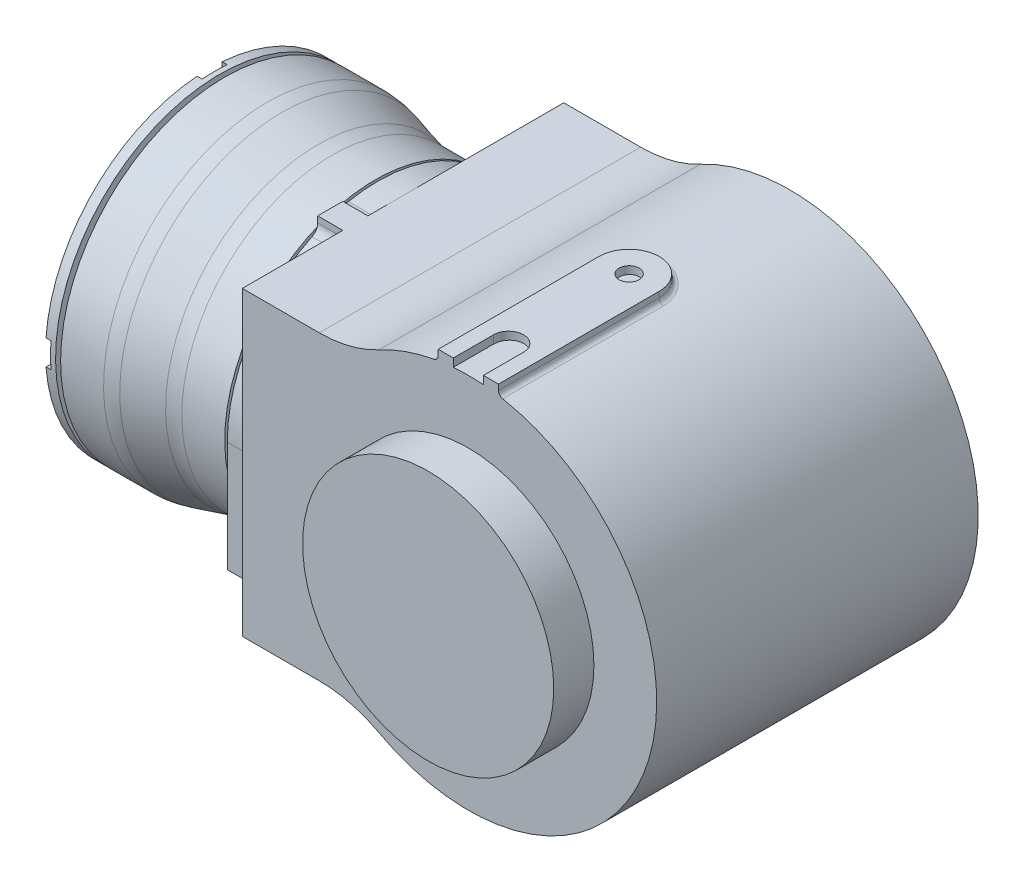
from build123d import *

# Parameters (mm, degrees)
ESBO_O1_R                 = 25
RESSALTO_EXTRUS_O1_DEPTH  = 40
RESSALTO_EXTRUS_O2_DEPTH  = 32
FILETE1_R                 = 25
ESBO_O3_R                 = 2
RESSALTO_EXTRUS_O3_DEPTH  = 39
ESBO_O4_W                 = 10
ESBO_O4_H                 = 30
ESBO_O4_R                 = 2
RESSALTO_EXTRUS_O4_DEPTH  = 39
FILETE2_R                 = 5
FILETE3_R                 = 1
ESBO_O5_R                 = 30
RESSALTO_EXTRUS_O5_DEPTH  = 5
RESSALTO_EXTRUS_O6_DEPTH  = 5
FILETE4_R                 = 2
FILETE4_R_2               = 1
ESBO_O7_R                 = 27.5
RESSALTO_EXTRUS_O7_DEPTH  = 0.5
ESBO_O8_R                 = 30
RESSALTO_EXTRUS_O8_DEPTH  = 10
ESBO_O9_R                 = 30
RESSALTO_EXTRUS_O9_DEPTH  = 10
RESSALTO_EXTRUS_O9_DRAFT  = -15
ESBO_O10_R                = 32.679491924
RESSALTO_EXTRUS_O10_DEPTH = 10
FILETE5_R                 = 11
ESBO_O11_R                = 25
RESSALTO_EXTRUS_O11_DEPTH = 1
ESBO_O12_R                = 32.679491924
RESSALTO_EXTRUS_O12_DEPTH = 2
CORTE_EXTRUS_O1_DEPTH     = 1
PADR_OCIRCULAR1_COUNT     = 4
ESBO_O14_R                = 17.5
CORTE_EXTRUS_O2_DEPTH     = 5
CORTE_EXTRUS_O2_DRAFT     = 15
ESBO_O16_R                = 17.5
RESSALTO_EXTRUS_O13_DEPTH = 6
RESSALTO_EXTRUS_O13_TAPER = 15
ESBO_O17_R                = 15.892304845
RESSALTO_EXTRUS_O14_DEPTH = 8
ESBO_O18_R                = 10
CORTE_EXTRUS_O3_DEPTH     = 5
PADR_OCIRCULAR2_COUNT     = 6


with BuildPart() as part:
    # Esboço1 → Ressalto-extrusão1 (new, symmetric)
    with BuildSketch(Plane.XY):
        Circle(ESBO_O1_R)
    extrude(amount=RESSALTO_EXTRUS_O1_DEPTH, both=True)

    # Esboço2 → Ressalto-extrusão2 (add, symmetric)
    with BuildSketch(Plane.XY):
        with BuildLine():
            Line((-22.5, 30), (-45, 30))
            Line((-45, 30), (-45, -30))
            Line((-45, -30), (-22.5, -30))
            ThreePointArc((-22.5, -30), (37.5, 0), (-22.5, 30))
        make_face()
    extrude(amount=RESSALTO_EXTRUS_O2_DEPTH, both=True)

    # Filete1
    filete1_edges = [part.edges().sort_by_distance(p)[0] for p in [
        (-22.5, -30, 0),
        (-22.5, 30, 0),
    ]]
    fillet(filete1_edges, radius=FILETE1_R)

    # Esboço3 → Ressalto-extrusão3 (add)
    with BuildSketch(Plane(origin=(0, 0, 0), x_dir=(1, 0, 0), z_dir=(0, 1, 0))):
        with BuildLine():
            Line((6, 0), (6, -32))
            Line((6, -32), (3, -32))
            Line((3, -32), (3, -24))
            ThreePointArc((3, -24), (0, -21), (-3, -24))
            Line((-3, -24), (-3, -32))
            Line((-3, -32), (-6, -32))
            Line((-6, -32), (-6, 0))
            ThreePointArc((-6, 0), (0, 6), (6, 0))
        make_face()
        with Locations(Location((0, 0, 0), (0, 0, 90))):
            Circle(ESBO_O3_R, mode=Mode.SUBTRACT)
    extrude(amount=RESSALTO_EXTRUS_O3_DEPTH)

    # Esboço4 → Ressalto-extrusão4 (add)
    with BuildSketch(Plane(origin=(0, 0, 0), x_dir=(1, 0, 0), z_dir=(0, 1, 0))):
        Rectangle(ESBO_O4_W, ESBO_O4_H)
        with Locations(Location((0, -10, 0), (0, 0, 270))):
            Circle(ESBO_O4_R, mode=Mode.SUBTRACT)
        with Locations(Location((0, 10, 0), (0, 0, 270))):
            Circle(ESBO_O4_R, mode=Mode.SUBTRACT)
    extrude(amount=-RESSALTO_EXTRUS_O4_DEPTH)

    # Filete2
    # the kernel refuses this fillet: 5 mm, written as the material it takes off along each edge
    with BuildSketch(Plane(origin=(-5, -24.665171868, 15), x_dir=(0, 0, -1), z_dir=(0, -1, 0))) as filete2_piece_1_section:
        with BuildLine():
            CenterArc((FILETE2_R, FILETE2_R), FILETE2_R, 180, 90)
            Line((0, FILETE2_R), (0, 0))
            Line((0, 0), (FILETE2_R, 0))
        make_face()
    filete2_piece_1 = extrude(amount=26.834828132, mode=Mode.PRIVATE)
    filete2_piece_1 = filete2_piece_1 - Plane(origin=(0, 0, 13.86345682), x_dir=(-0.6, -0.8, 0), z_dir=(0, 0, 1)) * Cylinder(37.5, 74, mode=Mode.PRIVATE)
    add(filete2_piece_1, mode=Mode.SUBTRACT)
    with BuildSketch(Plane(origin=(5, -24.665171868, 15), x_dir=(0, 0, -1), z_dir=(0, -1, 0))) as filete2_piece_2_section:
        with BuildLine():
            CenterArc((FILETE2_R, -FILETE2_R), FILETE2_R, 90, 90)
            Line((0, -FILETE2_R), (0, 0))
            Line((0, 0), (FILETE2_R, 0))
        make_face()
    filete2_piece_2 = extrude(amount=26.834828132, mode=Mode.PRIVATE)
    filete2_piece_2 = filete2_piece_2 - Plane(origin=(0, 0, 13.863454834), x_dir=(-0.6, -0.8, 0), z_dir=(0, 0, 1)) * Cylinder(37.5, 74, mode=Mode.PRIVATE)
    add(filete2_piece_2, mode=Mode.SUBTRACT)
    with BuildSketch(Plane(origin=(-5, -24.665171868, -15), x_dir=(0, 0, 1), z_dir=(0, -1, 0))) as filete2_piece_3_section:
        with BuildLine():
            CenterArc((FILETE2_R, -FILETE2_R), FILETE2_R, 90, 90)
            Line((0, -FILETE2_R), (0, 0))
            Line((0, 0), (FILETE2_R, 0))
        make_face()
    filete2_piece_3 = extrude(amount=26.834828132, mode=Mode.PRIVATE)
    filete2_piece_3 = filete2_piece_3 - Plane(origin=(0, 0, -13.86345682), x_dir=(-0.6, -0.8, 0), z_dir=(0, 0, 1)) * Cylinder(37.5, 74, mode=Mode.PRIVATE)
    add(filete2_piece_3, mode=Mode.SUBTRACT)
    with BuildSketch(Plane(origin=(5, -24.665171868, -15), x_dir=(-1, 0, 0), z_dir=(0, -1, 0))) as filete2_piece_4_section:
        with BuildLine():
            CenterArc((FILETE2_R, -FILETE2_R), FILETE2_R, 90, 90)
            Line((0, -FILETE2_R), (0, 0))
            Line((0, 0), (FILETE2_R, 0))
        make_face()
    filete2_piece_4 = extrude(amount=26.834828132, mode=Mode.PRIVATE)
    filete2_piece_4 = filete2_piece_4 - Plane(origin=(0, 0, -13.863464307), x_dir=(-0.6, -0.8, 0), z_dir=(0, 0, 1)) * Cylinder(37.5, 74, mode=Mode.PRIVATE)
    add(filete2_piece_4, mode=Mode.SUBTRACT)

    # Filete3
    filete3_edges = [part.edges().sort_by_distance(p)[0] for p in [
        (5, -37.165171868, 0),
        (6, 37.016888038, 16),
        (-6, 37.016888038, 16),
        (-5, -37.165171868, 0),
    ]]
    fillet(filete3_edges, radius=FILETE3_R)

    # Esboço5 → Ressalto-extrusão5 (add)
    with BuildSketch(Plane.ZY.offset(45)):
        with Locations(Location((0, 0, 0), (0, 0, 270))):
            Circle(ESBO_O5_R)
    extrude(amount=RESSALTO_EXTRUS_O5_DEPTH)

    # Esboço6 → Ressalto-extrusão6 (add)
    with BuildSketch(Plane.ZY.offset(45)):
        with BuildLine():
            Line((12, 27.49545417), (12, 30))
            Line((12, 30), (7, 30))
            Line((7, 30), (7, 29.171904292))
            ThreePointArc((7, 29.171904292), (9.53690837, 28.443758168), (12, 27.49545417))
        make_face()
        with BuildLine():
            Line((30, 0), (30, -22))
            ThreePointArc((30, -22), (27.171572875, -23.171572875), (26, -26))
            Line((26, -26), (26, -30))
            Line((26, -30), (0, -30))
            ThreePointArc((0, -30), (21.213203436, -21.213203436), (30, 0))
        make_face()
    extrude(amount=RESSALTO_EXTRUS_O6_DEPTH)

    # Filete4
    # the kernel refuses this fillet: 2, 1 mm, written as the material it adds along each edge
    with BuildSketch(Plane(origin=(-41.801162575, 27.49545417, 12), x_dir=(0, -0.41883929698999794, 0.9080603742576395), z_dir=(-1, 0, 0))) as filete4_piece_1:
        with BuildLine():
            CenterArc((1.280201221, 1.999573598), FILETE4_R, 204.761329125, 64.055520228)
            Line((-0.535919527, 1.161895004), (-0.572241942, 1.145141432))
            Line((-0.572241942, 1.145141432), (-0.036322415, -0.016753572))
            Line((-0.036322415, -0.016753572), (0.000825936, -0.039991472))
            ThreePointArc((0.000825936, -0.039991472), (0.619452204, -0.033603968), (1.238078471, -0.039991472))
            Line((1.238078471, -0.039991472), (1.238904408, 0))
        make_face()
    extrude(amount=8.198837425)
    with BuildSketch(Plane(origin=(-42.148865778, 29.171904292, 7), x_dir=(0, 0.21480828718559655, -0.9766562341767907), z_dir=(-1, 0, 0))) as filete4_piece_2:
        with BuildLine():
            CenterArc((1.15946125, -0.99981934), FILETE4_R_2, 91.089118639, 77.896551129)
            Line((0.177881821, -0.808764836), (0.158250232, -0.804943746))
            ThreePointArc((0.158250232, -0.804943746), (0.069407786, -0.408678584), (-0.019533125, -0.004296166))
            Line((-0.019533125, -0.004296166), (0.000380151, 0.019996387))
            ThreePointArc((0.000380151, 0.019996387), (0.570226844, 0.0145802), (1.140073538, 0.019996387))
            Line((1.140073538, 0.019996387), (1.140453689, 0))
        make_face()
    extrude(amount=7.851134222)

    # Esboço7 → Ressalto-extrusão7 (add)
    with BuildSketch(Plane.ZY.offset(50)):
        with Locations(Location((0, 0, 0), (0, 0, 270))):
            Circle(ESBO_O7_R)
    extrude(amount=RESSALTO_EXTRUS_O7_DEPTH)

    # Esboço8 → Ressalto-extrusão8 (add)
    with BuildSketch(Plane.ZY.offset(50.5)):
        with Locations(Location((0, 0, 0), (0, 0, 270))):
            Circle(ESBO_O8_R)
    extrude(amount=RESSALTO_EXTRUS_O8_DEPTH)


with BuildPart() as ressalto_extrus_o9_tool:
    # Esboço9 → Ressalto-extrusão9 (with draft: the straight prism first)
    with BuildSketch(Plane.ZY.offset(60.5)):
        with Locations(Location((0, 0, 0), (0, 0, 270))):
            Circle(ESBO_O9_R)
    extrude(amount=RESSALTO_EXTRUS_O9_DEPTH)
    # Ressalto-extrusão9: the draft: its side faces are tilted about the plane it starts from
    ressalto_extrus_o9_sides = [ressalto_extrus_o9_tool.faces().sort_by_distance(p)[0] for p in [
        (-65.5, 30, 0),
    ]]
    draft(ressalto_extrus_o9_sides, Plane.ZY.offset(60.5), RESSALTO_EXTRUS_O9_DRAFT)


with BuildPart() as part_1:
    add(part.part)

    # Ressalto-extrusão9: add ressalto_extrus_o9_tool
    add(ressalto_extrus_o9_tool.part)

    # Esboço10 → Ressalto-extrusão10 (add)
    with BuildSketch(Plane.ZY.offset(70.5)):
        with Locations(Location((0, 0, 0), (0, 0, 270))):
            Circle(ESBO_O10_R)
    extrude(amount=RESSALTO_EXTRUS_O10_DEPTH)

    # Filete5
    filete5_edges = [part_1.edges().sort_by_distance(p)[0] for p in [
        (-60.5, 30, 0),
        (-70.5, 32.679491924, 0),
    ]]
    fillet(filete5_edges, radius=FILETE5_R)

    # Esboço11 → Ressalto-extrusão11 (add)
    with BuildSketch(Plane.ZY.offset(80.5)):
        with Locations(Location((0, 0, 0), (0, 0, 270))):
            Circle(ESBO_O11_R)
    extrude(amount=RESSALTO_EXTRUS_O11_DEPTH)

    # Esboço12 → Ressalto-extrusão12 (add)
    with BuildSketch(Plane.ZY.offset(81.5)):
        with Locations(Location((0, 0, 0), (0, 0, 90))):
            Circle(ESBO_O12_R)
    extrude(amount=RESSALTO_EXTRUS_O12_DEPTH)

    # Esboço13 → Corte-extrusão1 (cut)
    with BuildSketch(Plane.ZY.offset(83.5)):
        with BuildLine():
            Line((2.5, 32.679491924), (2.5, 28.679491924))
            ThreePointArc((2.5, 28.679491924), (0, 26.179491924), (-2.5, 28.679491924))
            Line((-2.5, 28.679491924), (-2.5, 32.679491924))
            ThreePointArc((-2.5, 32.679491924), (0, 35.179491924), (2.5, 32.679491924))
        make_face()
    corte_extrus_o1 = extrude(amount=-CORTE_EXTRUS_O1_DEPTH, mode=Mode.SUBTRACT)

    # PadrãoCircular1: Corte-extrusão1 ×4 about axis
    padr_ocircular1_axis = Axis((0, 0, 0), (1, 0, 0))
    for i in range(1, PADR_OCIRCULAR1_COUNT):
        add(corte_extrus_o1.rotate(padr_ocircular1_axis, i * 360 / PADR_OCIRCULAR1_COUNT), mode=Mode.SUBTRACT)


with BuildPart() as corte_extrus_o2_tool:
    # Esboço14 → Corte-extrusão2 (with draft: the straight prism first)
    with BuildSketch(Plane.ZY.offset(83.5)):
        Circle(ESBO_O14_R)
    extrude(amount=-CORTE_EXTRUS_O2_DEPTH)
    # Corte-extrusão2: the draft: its side faces are tilted about the plane it starts from
    corte_extrus_o2_sides = [corte_extrus_o2_tool.faces().sort_by_distance(p)[0] for p in [
        (-81, 0, -17.5),
    ]]
    draft(corte_extrus_o2_sides, Plane.ZY.offset(83.5), CORTE_EXTRUS_O2_DRAFT)


with BuildPart() as part_2:
    add(part_1.part)

    # Corte-extrusão2: cut by corte_extrus_o2_tool
    add(corte_extrus_o2_tool.part, mode=Mode.SUBTRACT)

    # Esboço16 → Ressalto-extrusão13 (add)
    with BuildSketch(Plane.ZY.offset(78.5)):
        Circle(ESBO_O16_R)
    extrude(amount=RESSALTO_EXTRUS_O13_DEPTH, taper=RESSALTO_EXTRUS_O13_TAPER)

    # Esboço17 → Ressalto-extrusão14 (add)
    with BuildSketch(Plane.ZY.offset(84.5)):
        with Locations(Location((0, 0, 0), (0, 0, 270))):
            Circle(ESBO_O17_R)
    extrude(amount=RESSALTO_EXTRUS_O14_DEPTH)

    # Esboço18 → Corte-extrusão3 (cut)
    with BuildSketch(Plane.ZY.offset(92.5)):
        with Locations(Location((0, 0, 0), (0, 0, 270))):
            Circle(ESBO_O18_R)
    extrude(amount=-CORTE_EXTRUS_O3_DEPTH, mode=Mode.SUBTRACT)

    # Esboço20 → Furo roscado de M51 (revolve, cut)
    with BuildSketch(Plane(origin=(-92.5, 12.7, 0), x_dir=(0, 0, 1), z_dir=(0, 1, 0))):
        Polygon((0, 0), (0, 15.2618073), (2.1, 14), (2.1, 0), align=None)
    furo_roscado_de_m51 = revolve(axis=Axis((-98.85, 12.7, 0), (1, 0, 0)), mode=Mode.SUBTRACT)

    # PadrãoCircular2: Furo roscado de M51 ×6 about axis
    padr_ocircular2_axis = Axis((0, 0, 0), (1, 0, 0))
    for i in range(1, PADR_OCIRCULAR2_COUNT):
        add(furo_roscado_de_m51.rotate(padr_ocircular2_axis, i * 360 / PADR_OCIRCULAR2_COUNT), mode=Mode.SUBTRACT)


solid = part_2.part
